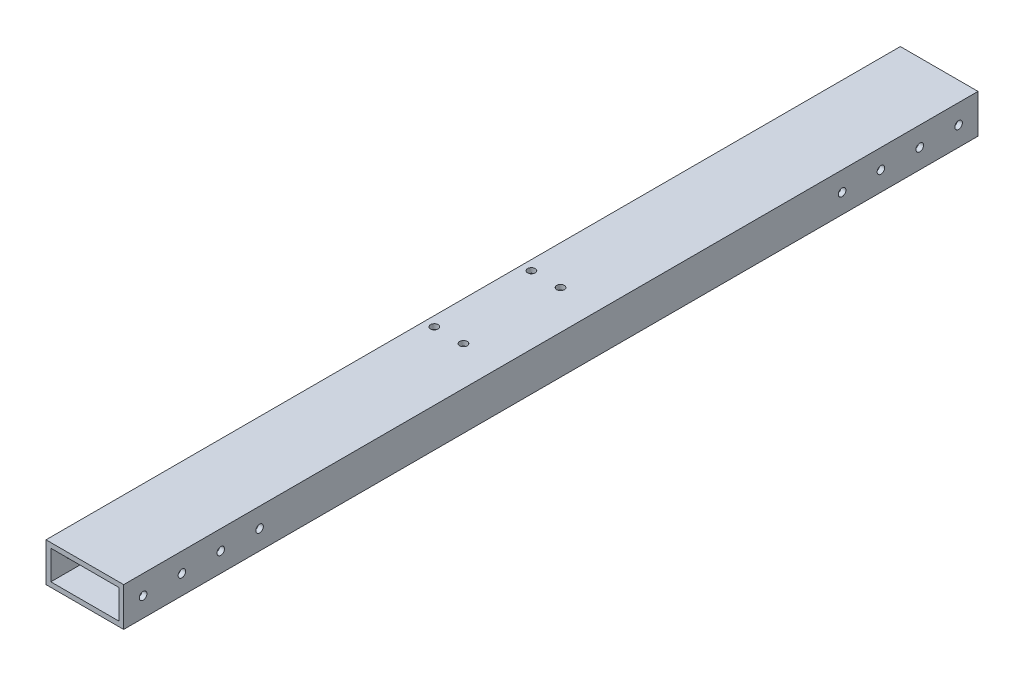
from build123d import *

# Parameters (mm, degrees)
SKETCH1_W               = 50.8
SKETCH1_H               = 25.4
BOSS_EXTRUDE1_DEPTH     = 279.4
SHELL1_T                = -3.175
CUT_EXTRUDE1_DEPTH      = 281.839473721
CUT_EXTRUDE1_DEPTH_BACK = 281.839473721
SKETCH3_R               = 2.4892
CUT_EXTRUDE2_DEPTH      = 281.839473721
CUT_EXTRUDE2_DEPTH_BACK = 281.839473721
SKETCH4_R               = 2.4892


with BuildPart() as part:
    # Sketch1 → Boss-Extrude1 (new, symmetric)
    with BuildSketch(Plane.XY):
        Rectangle(SKETCH1_W, SKETCH1_H)
    extrude(amount=BOSS_EXTRUDE1_DEPTH, both=True)

    # Shell1
    shell1_openings = [part.faces().sort_by_distance(p)[0] for p in [
        (0, 0, -279.4),
        (0, 0, 279.4),
    ]]
    offset(amount=SHELL1_T, openings=shell1_openings, kind=Kind.INTERSECTION)

    # Sketch3 → Cut-Extrude1 (cut, two sides: drawn at the far end of the back side and taken through both)
    with BuildSketch(Plane(origin=(0, 0, 0), x_dir=(0, 0, -1), z_dir=(1, 0, 0)).offset(-CUT_EXTRUDE1_DEPTH_BACK)):
        with Locations((-266.7, 0)):
            Circle(SKETCH3_R)
        with Locations((-241.3, 0)):
            Circle(SKETCH3_R)
        with Locations((-215.9, 0)):
            Circle(SKETCH3_R)
        with Locations((215.9, 0)):
            Circle(SKETCH3_R)
        with Locations((241.3, 0)):
            Circle(SKETCH3_R)
        with Locations((266.7, 0)):
            Circle(SKETCH3_R)
        with Locations((-190.5, 0)):
            Circle(SKETCH3_R)
        with Locations((190.5, 0)):
            Circle(SKETCH3_R)
    extrude(amount=CUT_EXTRUDE1_DEPTH + CUT_EXTRUDE1_DEPTH_BACK, mode=Mode.SUBTRACT)

    # Sketch4 → Cut-Extrude2 (cut, two sides: drawn at the far end of the back side and taken through both)
    with BuildSketch(Plane(origin=(0, 0, 0), x_dir=(1, 0, 0), z_dir=(0, 1, 0)).offset(-CUT_EXTRUDE2_DEPTH_BACK)):
        with Locations((0, -31.75)):
            Circle(SKETCH4_R)
        with Locations((-19.05, -31.75)):
            Circle(SKETCH4_R)
        with Locations((0, 31.75)):
            Circle(SKETCH4_R)
        with Locations((-19.05, 31.75)):
            Circle(SKETCH4_R)
    extrude(amount=CUT_EXTRUDE2_DEPTH + CUT_EXTRUDE2_DEPTH_BACK, mode=Mode.SUBTRACT)


solid = part.part
